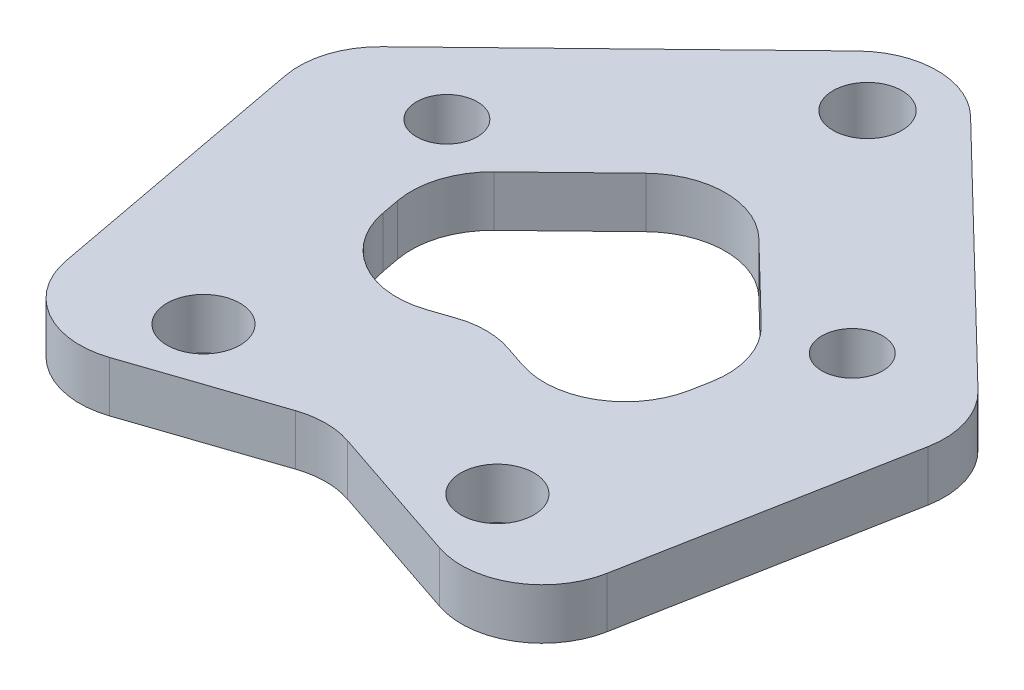
from build123d import *

# Parameters (mm, degrees)
BOSS_EXTRUDE1_DEPTH = 1.5875
SKETCH2_R           = 1.905000002
SKETCH2_R_2         = 2.159
SKETCH2_R_3         = 2.286
CUT_EXTRUDE1_DEPTH  = 67.497113893
CUT_EXTRUDE3_DEPTH  = 67.497113893
FILLET2_R           = 5.08


with BuildPart() as part:
    # Sketch1 → Boss-Extrude1 (new, symmetric)
    with BuildSketch(Plane(origin=(0, 0, 0), x_dir=(1, 0, 0), z_dir=(0, 1, 0))):
        Polygon((11.747499998, 20.0025), (32.384999998, 40.005), (53.022499998, 20.0025), (48.259999998, -5.350948553), (32.384999998, 0), (16.509999998, -5.350948553), align=None)
    extrude(amount=BOSS_EXTRUDE1_DEPTH, both=True)

    # Sketch2 → Cut-Extrude1 (cut, through all)
    with BuildSketch(Plane(origin=(0, -1.5875, 0), x_dir=(1, 0, 0), z_dir=(0, 1, 0))):
        with Locations((19.684999998, 20.0025)):
            Circle(SKETCH2_R)
        with Locations((45.084999998, 20.0025)):
            Circle(SKETCH2_R)
        with Locations((32.385, 33.655)):
            Circle(SKETCH2_R_2)
        with Locations((23.1775, 1.25970321)):
            Circle(SKETCH2_R_3)
        with Locations((41.5925, 1.25970321)):
            Circle(SKETCH2_R_3)
    extrude(amount=CUT_EXTRUDE1_DEPTH, mode=Mode.SUBTRACT)

    # Sketch4 → Cut-Extrude3 (cut, through all)
    with BuildSketch(Plane(origin=(0, 1.5875, 0), x_dir=(1, 0, 0), z_dir=(0, 1, 0))):
        Polygon((22.054298951, 16.727400238), (23.848801586, 7.17426003), (32.384999998, 10.051536159), (40.92119841, 7.17426003), (42.715701046, 16.727400238), (32.384999998, 26.74023356), align=None)
    extrude(amount=-CUT_EXTRUDE3_DEPTH, mode=Mode.SUBTRACT)

    # Fillet2
    fillet2_edges = [part.edges().sort_by_distance(p)[0] for p in [
        (23.848801586, 0, -7.17426003),
        (32.384999998, 0, -10.051536159),
        (40.92119841, 0, -7.17426003),
        (42.715701046, 0, -16.727400238),
        (32.384999998, 0, -26.74023356),
        (22.054298951, 0, -16.727400238),
        (11.747499998, 0, -20.0025),
        (32.384999998, 0, -40.005),
        (53.022499998, 0, -20.0025),
        (32.384999998, 0, 0),
        (16.509999998, 0, 5.350948553),
        (48.259999998, 0, 5.350948553),
    ]]
    fillet(fillet2_edges, radius=FILLET2_R)


solid = part.part
